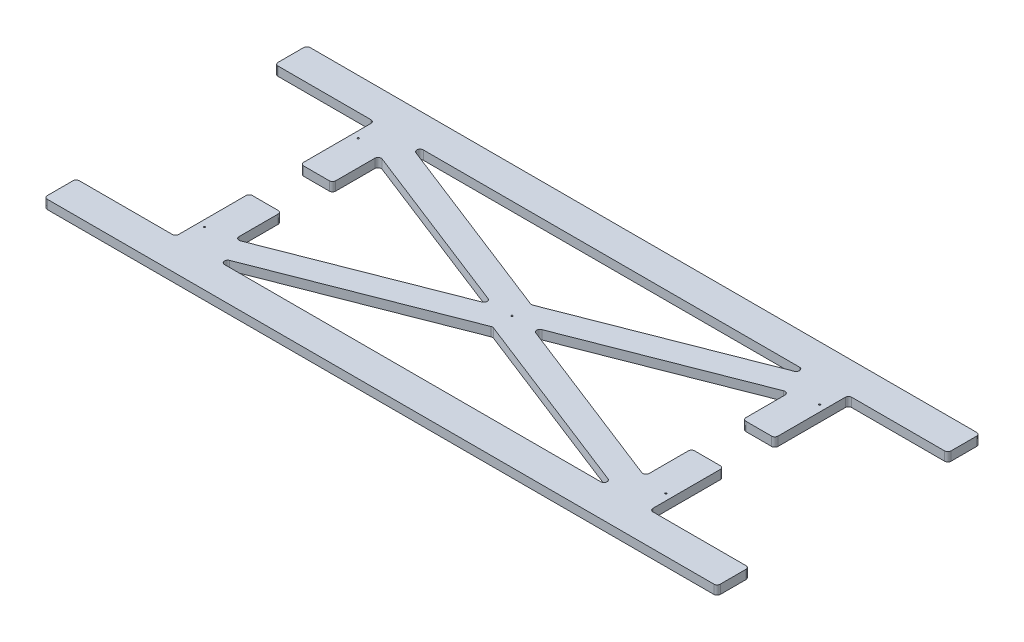
from build123d import *

# Parameters (mm, degrees)
SKETCH1_W                    = 1333.5
SKETCH1_H                    = 520.7
BOSS_EXTRUDE1_DEPTH          = 17.78
FILLET1_R                    = 6.35
F_1_8_0_125_DIAMETER_HOLE1_D = 3.175
SKETCH5_W                    = 152.4
SKETCH5_H                    = 393.7
CUT_EXTRUDE1_DEPTH           = 716.998473043
FILLET2_R                    = 6.35
SKETCH6_W                    = 50.8
SKETCH6_H                    = 393.7
SKETCH6_W_2                  = 63.5
SKETCH6_H_2                  = 101.6
CUT_EXTRUDE2_DEPTH           = 716.998473043
FILLET3_R                    = 6.35


with BuildPart() as part:
    # Sketch1 → Boss-Extrude1 (new body)
    with BuildSketch(Plane(origin=(0, 0, 0), x_dir=(1, 0, 0), z_dir=(0, 1, 0))):
        Rectangle(SKETCH1_W, SKETCH1_H)
    extrude(amount=BOSS_EXTRUDE1_DEPTH)

    # Fillet1
    fillet1_edges = [part.edges().sort_by_distance(p)[0] for p in [
        (-666.75, 8.89, 260.35),
        (-666.75, 8.89, -260.35),
        (666.75, 8.89, -260.35),
        (666.75, 8.89, 260.35),
    ]]
    fillet(fillet1_edges, radius=FILLET1_R)

    # 1/8 (0.125) Diameter Hole1 (through all)
    with Locations(Plane(origin=(0, 17.78, 0), x_dir=(1, 0, 0), z_dir=(0, 1, 0))):
        with Locations((0, 0), (457.2, 152.4), (-457.2, -152.4), (-457.2, 152.4), (457.2, -152.4)):
            Hole(F_1_8_0_125_DIAMETER_HOLE1_D / 2)

    # Sketch5 → Cut-Extrude1 (cut, through all)
    with BuildSketch(Plane(origin=(0, 17.78, 0), x_dir=(1, 0, 0), z_dir=(0, 1, 0))):
        Polygon((-406.4, 196.85), (406.4, 196.85), (0, 38.1), align=None)
        Polygon((0, -38.1), (-406.4, -196.85), (406.4, -196.85), align=None)
        Polygon((406.4, 143.8671875), (406.4, -143.8671875), (38.1, 0), align=None)
        Polygon((-406.4, 143.8671875), (-38.1, 0), (-406.4, -143.8671875), align=None)
        with Locations((546.1, 0)):
            Rectangle(SKETCH5_W, SKETCH5_H)
        with Locations((-546.1, 0)):
            Rectangle(SKETCH5_W, SKETCH5_H)
    extrude(amount=-CUT_EXTRUDE1_DEPTH, mode=Mode.SUBTRACT)

    # Fillet2
    fillet2_edges = [part.edges().sort_by_distance(p)[0] for p in [
        (469.9, 8.89, -196.85),
        (469.9, 8.89, 196.85),
        (622.3, 8.89, 196.85),
        (406.4, 8.89, 143.8671875),
        (406.4, 8.89, 196.85),
        (622.3, 8.89, -196.85),
        (406.4, 8.89, -143.8671875),
        (406.4, 8.89, -196.85),
        (38.1, 8.89, 0),
        (0, 8.89, 38.1),
        (0, 8.89, -38.1),
        (-38.1, 8.89, 0),
        (-406.4, 8.89, 196.85),
        (-406.4, 8.89, -196.85),
        (-406.4, 8.89, -143.8671875),
        (-406.4, 8.89, 143.8671875),
        (-622.3, 8.89, 196.85),
        (-469.9, 8.89, 196.85),
        (-469.9, 8.89, -196.85),
        (-622.3, 8.89, -196.85),
    ]]
    fillet(fillet2_edges, radius=FILLET2_R)

    # Sketch6 → Cut-Extrude2 (cut, through all)
    with BuildSketch(Plane(origin=(0, 17.78, 0), x_dir=(1, 0, 0), z_dir=(0, 1, 0))):
        with Locations((641.35, 0)):
            Rectangle(SKETCH6_W, SKETCH6_H)
        with Locations((-641.35, 0)):
            Rectangle(SKETCH6_W, SKETCH6_H)
        with Locations((-438.15, 0)):
            Rectangle(SKETCH6_W_2, SKETCH6_H_2)
        with Locations((438.15, 0)):
            Rectangle(SKETCH6_W_2, SKETCH6_H_2)
    extrude(amount=-CUT_EXTRUDE2_DEPTH, mode=Mode.SUBTRACT)

    # Fillet3
    fillet3_edges = [part.edges().sort_by_distance(p)[0] for p in [
        (-666.75, 8.89, 196.85),
        (-666.75, 8.89, -196.85),
        (666.75, 8.89, -196.85),
        (666.75, 8.89, 196.85),
        (-406.4, 8.89, 50.8),
        (-406.4, 8.89, -50.8),
        (-469.9, 8.89, 50.8),
        (-469.9, 8.89, -50.8),
        (469.9, 8.89, -50.8),
        (406.4, 8.89, -50.8),
        (469.9, 8.89, 50.8),
        (406.4, 8.89, 50.8),
    ]]
    fillet(fillet3_edges, radius=FILLET3_R)


solid = part.part
